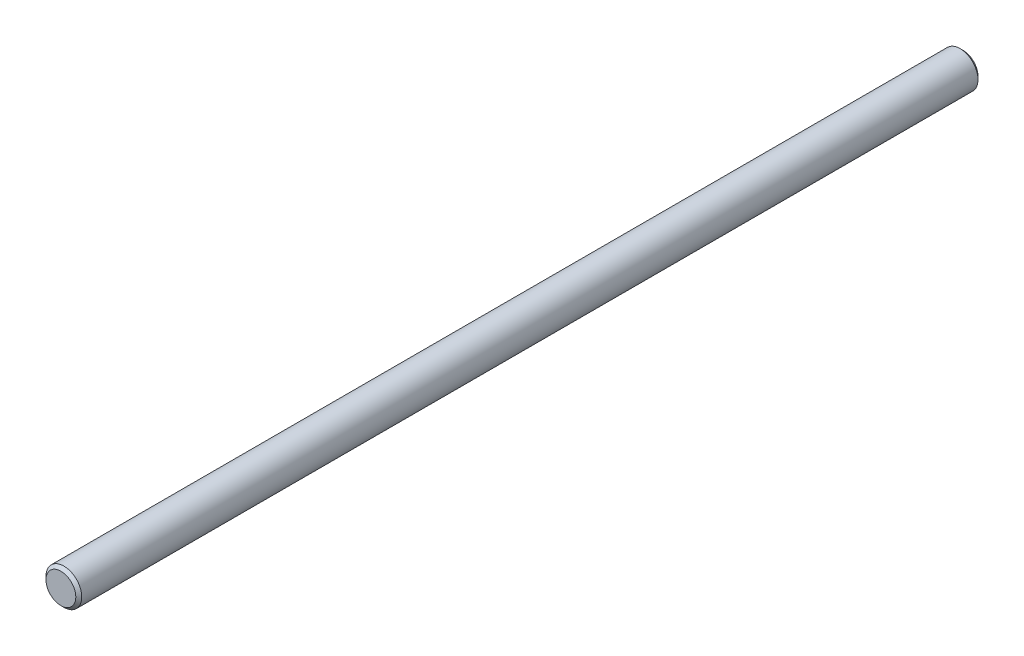
from build123d import *

# Parameters (mm, degrees)
SKETCH1_R           = 6
BOSS_EXTRUDE1_DEPTH = 151.25
CHAMFER1_SIZE       = 1


with BuildPart() as part:
    # Sketch1 → Boss-Extrude1 (new, symmetric)
    with BuildSketch(Plane.XY):
        Circle(SKETCH1_R)
    extrude(amount=BOSS_EXTRUDE1_DEPTH, both=True)

    # Chamfer1
    chamfer1_edges = [part.edges().sort_by_distance(p)[0] for p in [
        (-6, 0, -151.25),
        (-6, 0, 151.25),
    ]]
    chamfer(chamfer1_edges, length=CHAMFER1_SIZE)


solid = part.part
